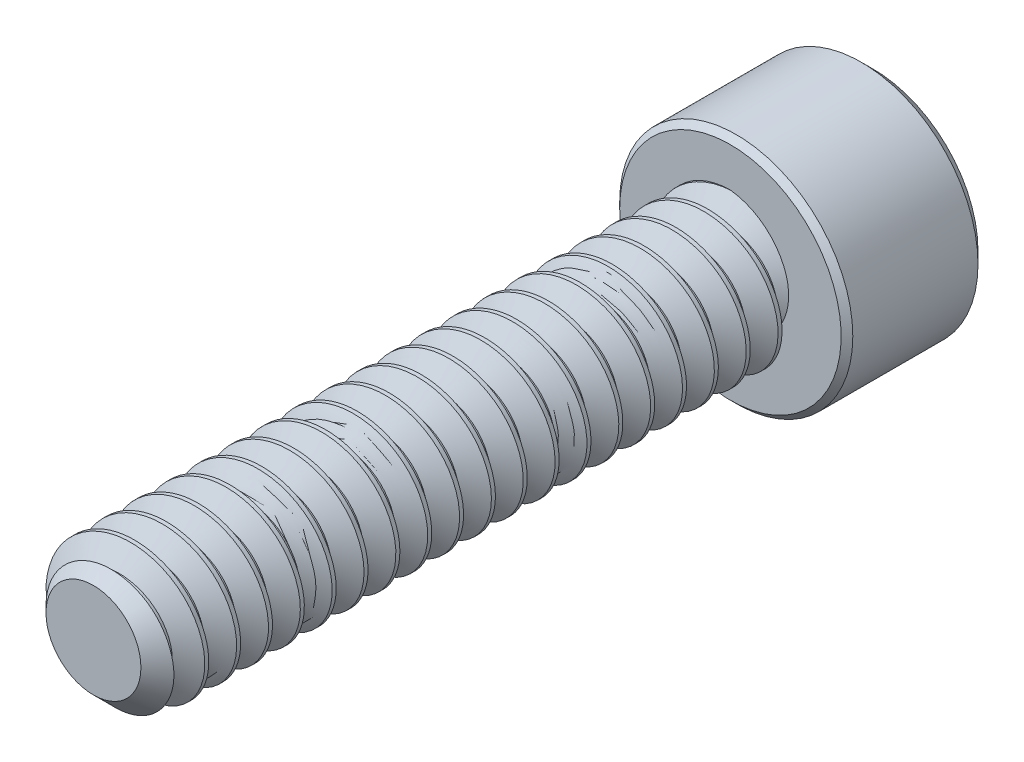
from build123d import *

# Parameters (mm, degrees)
SKETCH1_R          = 1.4224
EXTRUDE1_DEPTH     = 12.7
CHAMFER3_SIZE      = 0.47625
CUT_SWEEP1_PITCH   = 0.635
SKETCH6_R          = 2.3241
EXTRUDE2_DEPTH     = 2.8448
CUT_EXTRUDE1_DEPTH = 1.7859375
CHAMFER1_SIZE      = 0.23241
CHAMFER2_SIZE      = 0.116205


with BuildPart() as part:
    # Sketch1 → Extrude1 (new body)
    with BuildSketch(Plane.XY):
        Circle(SKETCH1_R)
    extrude(amount=-EXTRUDE1_DEPTH)

    # Chamfer3
    chamfer3_edges = [part.edges().sort_by_distance(p)[0] for p in [
        (-1.4224, 0, 0),
    ]]
    chamfer(chamfer3_edges, length=CHAMFER3_SIZE)

    # Cut-Sweep1: the profile of Sketch3 profile screwed along a right-hand helix of 21 turns, 6 arcs to a turn; built about Z, then put on its axis
    cut_sweep1_z = Axis((0, 0, 0), (0, 0, 1))
    cut_sweep1_corners = [(1.4227, 0, -0.555798205), (1.009955401, 0, -0.3175), (1.009955401, 0, -0.238125), (1.4227, 0, 0.000173205)]
    with BuildLine(mode=Mode.PRIVATE) as cut_sweep1_profile:
        Line(cut_sweep1_corners[0], cut_sweep1_corners[1])
        Line(cut_sweep1_corners[1], cut_sweep1_corners[2])
        Line(cut_sweep1_corners[2], cut_sweep1_corners[3])
        Line(cut_sweep1_corners[3], cut_sweep1_corners[0])
    cut_sweep1_cap = Face(cut_sweep1_profile.wire())
    cut_sweep1_turn_angles = [0, 30, 60, 90, 120, 150, 180, 210, 240, 270, 300, 330, 360]
    cut_sweep1_turn_weights = [1, 0.8660254037844387, 1, 0.8660254037844387, 1, 0.8660254037844387, 1, 0.8660254037844387, 1, 0.8660254037844387, 1, 0.8660254037844387, 1]
    cut_sweep1_turn_rails = [Edge.make_bspline([Vector(p[0], p[1], 0).rotate(cut_sweep1_z, cut_sweep1_turn_angles[k]) / cut_sweep1_turn_weights[k] + Vector(0, 0, p[2] + CUT_SWEEP1_PITCH * cut_sweep1_turn_angles[k] / 360) for k in range(13)], [0, 0, 0, 1, 1, 2, 2, 3, 3, 4, 4, 5, 5, 6, 6, 6], 2, cut_sweep1_turn_weights) for p in cut_sweep1_corners]
    cut_sweep1_turn_sides = [Face.make_surface_from_curves(cut_sweep1_turn_rails[p[0]], cut_sweep1_turn_rails[p[1]]) for p in [(0, 1), (1, 2), (2, 3), (3, 0)]]
    cut_sweep1 = Plane(origin=(0, 0, 0), x_dir=(0, 1, 0), z_dir=(0, 0, -1)) * Solid(Shell([*[p.moved(Location((0, 0, CUT_SWEEP1_PITCH * i))) for i in range(21) for p in cut_sweep1_turn_sides], cut_sweep1_cap, cut_sweep1_cap.rotate(cut_sweep1_z, 7560).moved(Location((0, 0, CUT_SWEEP1_PITCH * 7560 / 360)))]))
    add(cut_sweep1, mode=Mode.SUBTRACT)

    # Sketch6 → Extrude2 (add)
    with BuildSketch(Plane(origin=(0, 0, -12.7), x_dir=(-1, 0, 0), z_dir=(0, 0, -1))):
        Circle(SKETCH6_R)
    extrude(amount=EXTRUDE2_DEPTH)

    # Sketch7 → Cut-Extrude1 (cut)
    with BuildSketch(Plane(origin=(0, 0, -15.5448), x_dir=(-1, 0, 0), z_dir=(0, 0, -1))):
        Polygon((0, 1.374815329), (-1.190625, 0.687407664), (-1.190625, -0.687407664), (0, -1.374815329), (1.190625, -0.687407664), (1.190625, 0.687407664), align=None)
    extrude(amount=-CUT_EXTRUDE1_DEPTH, mode=Mode.SUBTRACT)

    # Cut-Extrude2 cone 1 section (through the dimple's axis) → Cut-Extrude2 (revolve, cut)
    with BuildSketch(Plane(origin=(0, 0, -15.5448), x_dir=(0, 1, 0), z_dir=(1, 0, 0))):
        Polygon((0, 0), (1.374815329, 0), (0, 1.374815329), align=None)
    revolve(axis=Axis((0, 0, -15.5448), (0, 0, 1)), mode=Mode.SUBTRACT)

    # Chamfer1
    chamfer1_edges = [part.edges().sort_by_distance(p)[0] for p in [
        (2.3241, 0, -15.5448),
    ]]
    chamfer(chamfer1_edges, length=CHAMFER1_SIZE)

    # Chamfer2
    chamfer2_edges = [part.edges().sort_by_distance(p)[0] for p in [
        (2.3241, 0, -12.7),
    ]]
    chamfer(chamfer2_edges, length=CHAMFER2_SIZE)


solid = part.part
